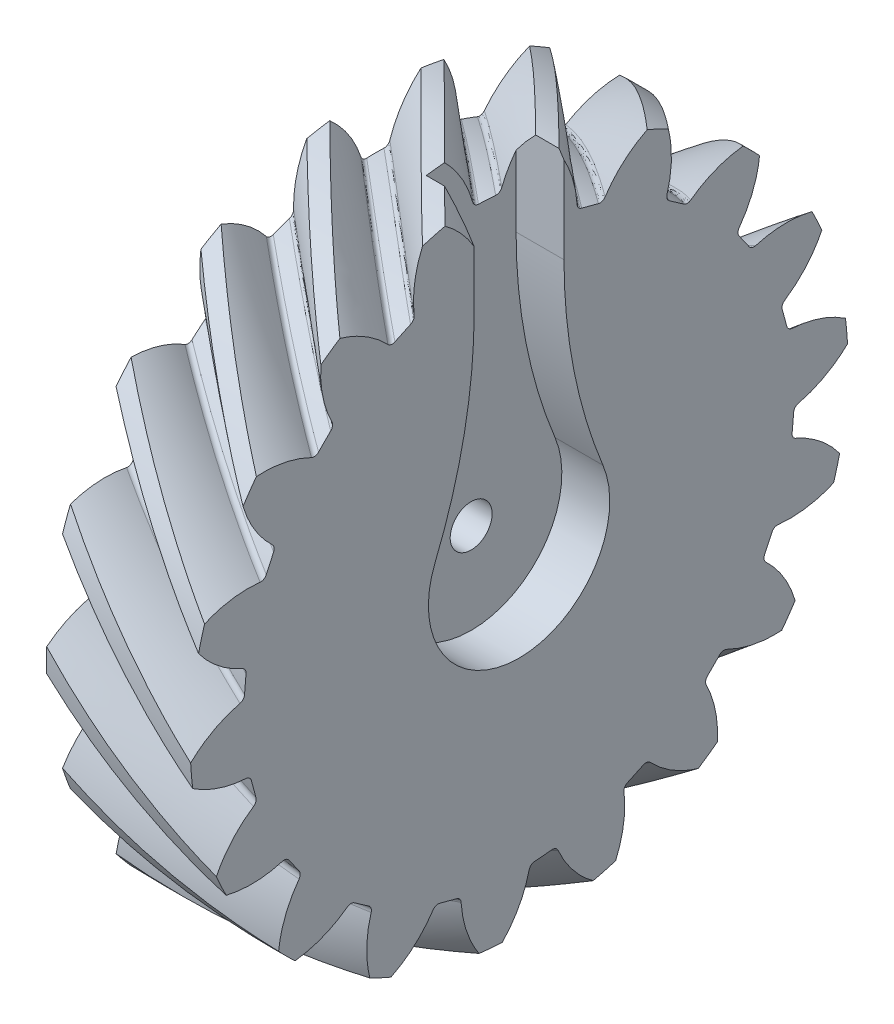
from build123d import *

# Parameters (mm, degrees)
BASPROSKE_W            = 12
BASPROSKE_H            = 27.455844123
TOOTHCUTRH_PITCH       = 172.510156388
TOOTHCUTRH_HEIGHT      = 12
TOOTHCUTRH_RADIUS      = 27.455844123
TOOTHCUTRH_START_ANGLE = -90
TEETHCUTSRH_COUNT      = 18
TEETHCUTSRH_ANGLE      = 340
BORSKE_R               = 1.5
BORE_DEPTH             = 62.5000025
CUT_EXTRUDE1_DEPTH     = 4
SKETCH4_R              = 1.75
CUT_EXTRUDE2_DEPTH     = 40.644000373


with BuildPart() as part:
    # BasProSke → Base-Revolve (revolve)
    with BuildSketch(Plane(origin=(0, 0, 0), x_dir=(1, 0, 0), z_dir=(0, 1, 0)), mode=Mode.PRIVATE) as base_revolve_sk:
        with Locations((6, 13.727922062)):
            Rectangle(BASPROSKE_W, BASPROSKE_H)
    revolve(base_revolve_sk.sketch.rotate(Axis((-10, 0, 0), (1, 0, 0)), 180), axis=Axis((-10, 0, 0), (1, 0, 0)))

    # ToothCutRH: sweep along a helix
    with BuildLine() as toothcutrh_path:
        add(Helix(TOOTHCUTRH_PITCH, TOOTHCUTRH_HEIGHT, TOOTHCUTRH_RADIUS, center=(0, 0, 0), direction=(1, 0, 0), mode=Mode.PRIVATE).rotate(Axis((0, 0, 0), (1, 0, 0)), TOOTHCUTRH_START_ANGLE))
    # TooCutSkeRH → ToothCutRH (sweep, cut)
    with BuildSketch(Plane(origin=(0, 0, 0), x_dir=(0, 0, -1), z_dir=(1, 0, 0))):
        with BuildLine():
            ThreePointArc((0.719832214, 22.944555367), (0, 22.955844123), (-0.719832214, 22.944555367))
            ThreePointArc((-0.719832214, 22.944555367), (-1.021785859, 23.034133161), (-1.210610775, 23.286215165))
            ThreePointArc((-1.210610775, 23.286215165), (-2.579137782, 25.873755641), (-4.705650677, 27.885266214))
            ThreePointArc((-4.705650677, 27.885266214), (0, 28.279519446), (4.705650677, 27.885266214))
            ThreePointArc((4.705650677, 27.885266214), (2.579137782, 25.873755641), (1.210610775, 23.286215165))
            ThreePointArc((1.210610775, 23.286215165), (1.021785859, 23.034133161), (0.719832214, 22.944555367))
        make_face()
    toothcutrh = sweep(path=toothcutrh_path.line, is_frenet=True, mode=Mode.SUBTRACT)

    # TeethCutsRH: ToothCutRH ×18 about axis
    teethcutsrh_axis = Axis((-10, 0, 0), (1, 0, 0))
    for i in range(1, TEETHCUTSRH_COUNT):
        add(toothcutrh.rotate(teethcutsrh_axis, i * TEETHCUTSRH_ANGLE / (TEETHCUTSRH_COUNT - 1)), mode=Mode.SUBTRACT)

    # BorSke → Bore (cut, symmetric)
    with BuildSketch(Plane(origin=(0, 0, 0), x_dir=(0, 0, -1), z_dir=(1, 0, 0))):
        with Locations(Location((0, 0, 0), (0, 0, 180))):
            Circle(BORSKE_R)
    extrude(amount=BORE_DEPTH, both=True, mode=Mode.SUBTRACT)

    # Sketch3 → Cut-Extrude1 (cut)
    with BuildSketch(Plane(origin=(12, 0, 0), x_dir=(0, 0, -1), z_dir=(1, 0, 0))):
        with BuildLine():
            Line((-3.75, 32.35329558), (3.75, 32.35329558))
            Line((3.75, 32.35329558), (3.75, 19.360227271))
            ThreePointArc((3.75, 19.360227271), (4.570928707, 10.958876912), (7.002658427, 2.875356493))
            ThreePointArc((7.002658427, 2.875356493), (0, -7.57), (-7.002658427, 2.875356493))
            ThreePointArc((-7.002658427, 2.875356493), (-4.570928707, 10.958876912), (-3.75, 19.360227271))
            Line((-3.75, 19.360227271), (-3.75, 32.35329558))
        make_face()
    extrude(amount=-CUT_EXTRUDE1_DEPTH, mode=Mode.SUBTRACT)

    # Sketch4 → Cut-Extrude2 (cut, through all)
    with BuildSketch(Plane(origin=(8, 0, 0), x_dir=(0, 0, -1), z_dir=(1, 0, 0))):
        Circle(SKETCH4_R)
    extrude(amount=-CUT_EXTRUDE2_DEPTH, mode=Mode.SUBTRACT)


solid = part.part
